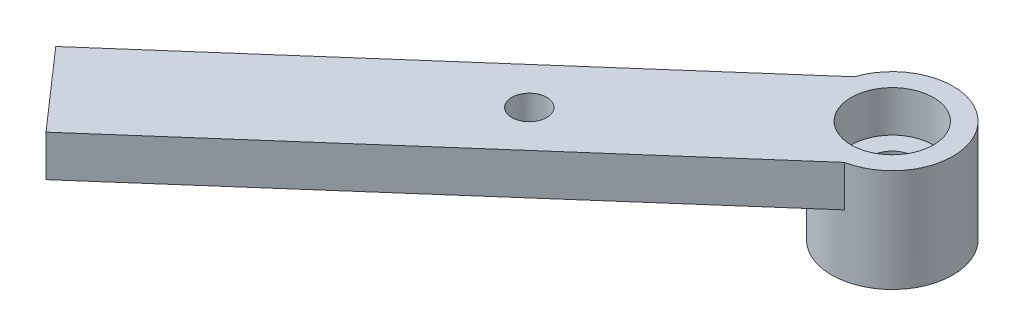
from build123d import *

# Parameters (mm, degrees)
EXTRUDE_START       = -4
EXTRUDE_1_OUTLINE_R = 4
EXTRUDE_1_DEPTH     = 4
EXTRUDE_START_2     = 6
SKETCH_2_R          = 5.9
SKETCH_2_R_2        = 2.1
EXTRUDE_2_DEPTH     = 6
SKETCH_3_R          = 1.7
CUT_EXTRUDE_1_DEPTH = 4


# Read off the part's stored shape, not the designer's step: 填料-伸長1
with BuildPart() as part:
    # 填料-伸長1 outline → 填料-伸長1 (new body)
    with BuildSketch(Plane(origin=(0, 20.156954032, 0), x_dir=(1, 0, 0), z_dir=(0, 1, 0)).offset(EXTRUDE_START)):
        with BuildLine():
            Line((-94.580009895, -253.67166291), (-53.224889363, -217.412126153))
            ThreePointArc((-53.224889363, -217.412126153), (-49.935495794, -207.73500968), (-59.959608209, -209.730971497))
            Line((-59.959608209, -209.730971497), (-101.314728741, -245.990508253))
            Line((-101.314728741, -245.990508253), (-94.580009895, -253.67166291))
        make_face()
        with Locations((-54.371772361, -211.624669079)):
            Circle(EXTRUDE_1_OUTLINE_R, mode=Mode.SUBTRACT)
    extrude(amount=EXTRUDE_1_DEPTH)

    # 草圖2 → 填料-伸長2 (add)
    with BuildSketch(Plane.XZ.offset(-16.156954032).offset(EXTRUDE_START_2)):
        with Locations(Location((-54.371772361, 211.624669079, 0), (0, 0, 198.721335886))):
            Circle(SKETCH_2_R)
        with Locations((-54.371772361, 211.624669079)):
            Circle(SKETCH_2_R_2, mode=Mode.SUBTRACT)
    extrude(amount=-EXTRUDE_2_DEPTH)

    # 草圖3 → 除料-伸長1 (cut)
    with BuildSketch(Plane.XZ.offset(-16.156954032)):
        with Locations((-73.169554421, 228.106276695)):
            Circle(SKETCH_3_R)
    extrude(amount=-CUT_EXTRUDE_1_DEPTH, mode=Mode.SUBTRACT)


solid = part.part
